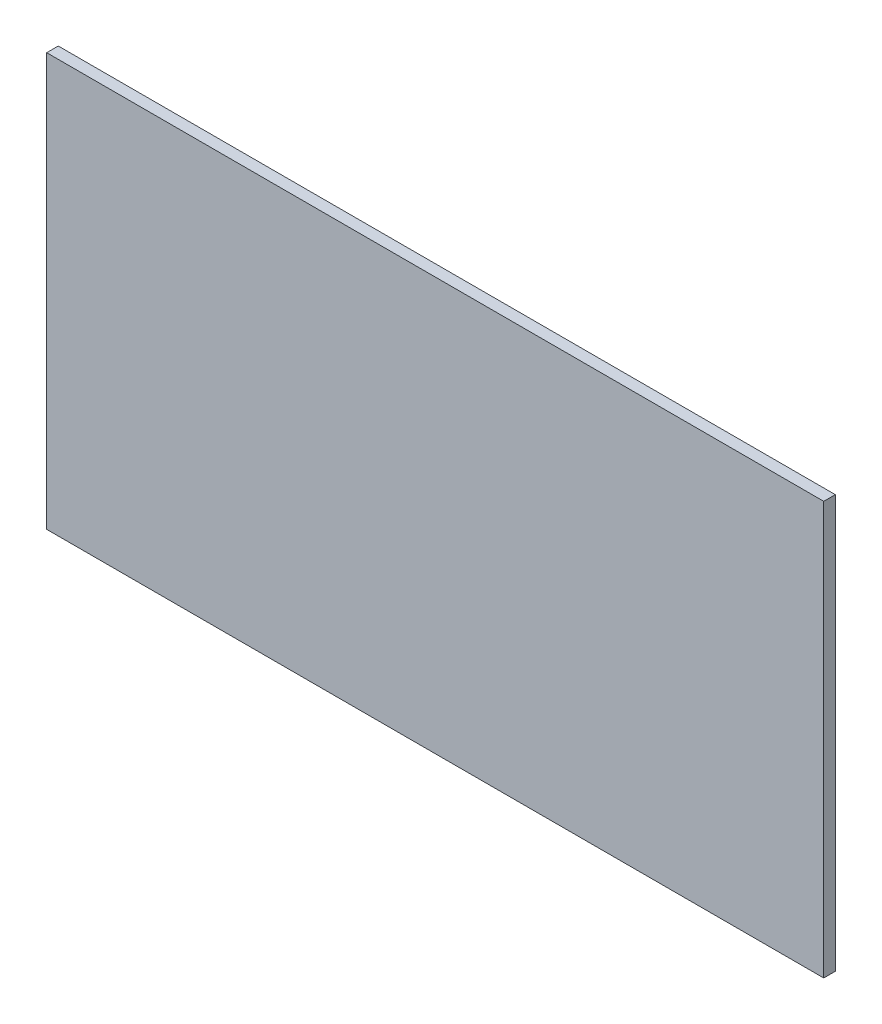
from build123d import *

# Parameters (mm, degrees)
IZIM1_W                    = 1508
IZIM1_H                    = 1970
TABAN_FLAN_1_DEPTH         = 15
KES_EKSTR_ZYON1_DEPTH      = 2481.965336316
KES_EKSTR_ZYON1_DEPTH_BACK = 2481.965336316
IZIM2_W                    = 501
IZIM2_H                    = 1970
KES_EKSTR_ZYON2_DEPTH      = 2481.965336316
KES_EKSTR_ZYON2_DEPTH_BACK = 2481.965336316
IZIM3_W                    = 1007
IZIM3_H                    = 310
KES_EKSTR_ZYON3_DEPTH      = 2481.965336316
KES_EKSTR_ZYON3_DEPTH_BACK = 2481.965336316
IZIM4_W                    = 1007
IZIM4_H                    = 1125


# Sheet-metal steps are written as plain solids
with BuildPart() as part:
    # Çizim1 → Taban-Flanş1 (new body)
    with BuildSketch(Plane.XY):
        with Locations((754, -985)):
            Rectangle(IZIM1_W, IZIM1_H)
    extrude(amount=-TABAN_FLAN_1_DEPTH)

    # Çizim2 → Kes-Ekstrüzyon1 (cut, two sides: drawn at the far end of the back side and taken through both)
    with BuildSketch(Plane.XY.offset(-KES_EKSTR_ZYON1_DEPTH_BACK)):
        with Locations((250.5, -985)):
            Rectangle(IZIM2_W, IZIM2_H)
    extrude(amount=KES_EKSTR_ZYON1_DEPTH + KES_EKSTR_ZYON1_DEPTH_BACK, mode=Mode.SUBTRACT)

    # Çizim3 → Kes-Ekstrüzyon2 (cut, two sides: drawn at the far end of the back side and taken through both)
    with BuildSketch(Plane.XY.offset(-KES_EKSTR_ZYON2_DEPTH_BACK)):
        with Locations((1004.5, -155)):
            Rectangle(IZIM3_W, IZIM3_H)
    extrude(amount=KES_EKSTR_ZYON2_DEPTH + KES_EKSTR_ZYON2_DEPTH_BACK, mode=Mode.SUBTRACT)

    # Çizim4 → Kes-Ekstrüzyon3 (cut, two sides: drawn at the far end of the back side and taken through both)
    with BuildSketch(Plane.XY.offset(-KES_EKSTR_ZYON3_DEPTH_BACK)):
        with Locations((1004.5, -872.5)):
            Rectangle(IZIM4_W, IZIM4_H)
    extrude(amount=KES_EKSTR_ZYON3_DEPTH + KES_EKSTR_ZYON3_DEPTH_BACK, mode=Mode.SUBTRACT)


solid = part.part
